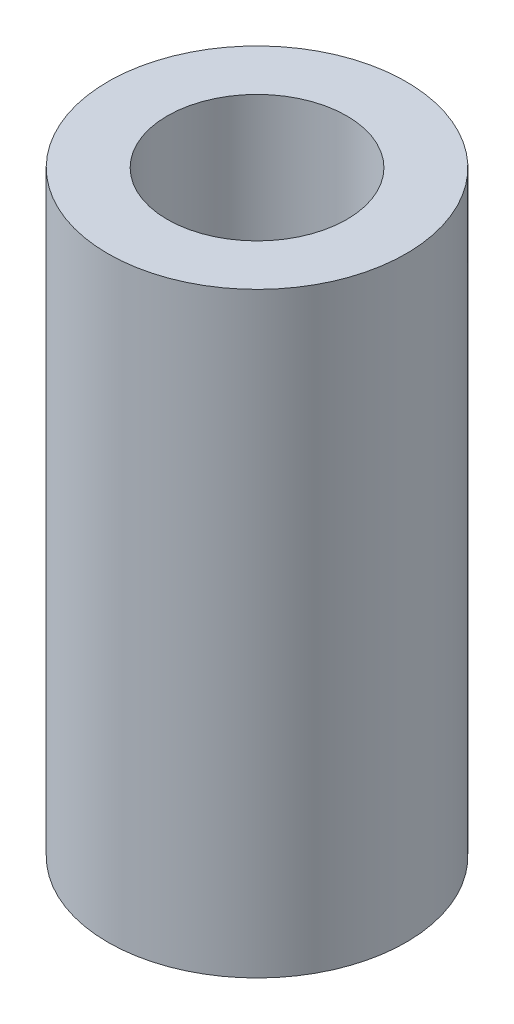
from build123d import *

# Parameters (mm, degrees)
SKETCH1_R           = 25
SKETCH1_R_2         = 15.05
BOSS_EXTRUDE1_DEPTH = 100


with BuildPart() as part:
    # Sketch1 → Boss-Extrude1 (new body)
    with BuildSketch(Plane(origin=(0, 0, 0), x_dir=(1, 0, 0), z_dir=(0, 1, 0))):
        Circle(SKETCH1_R)
        Circle(SKETCH1_R_2, mode=Mode.SUBTRACT)
    extrude(amount=BOSS_EXTRUDE1_DEPTH)


solid = part.part
